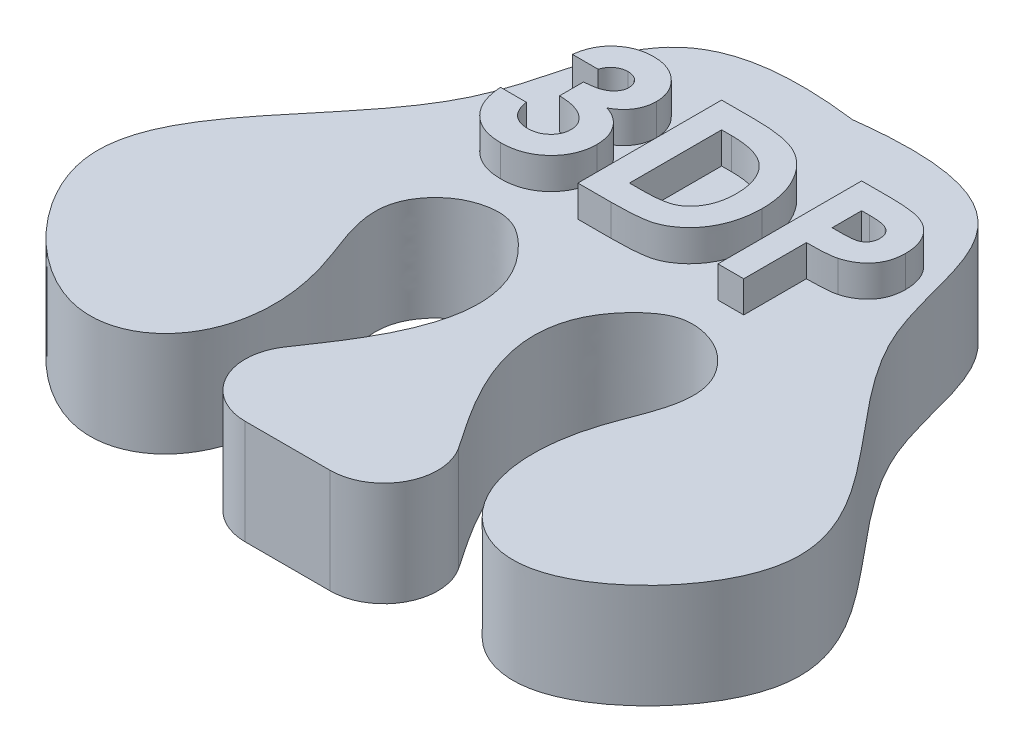
from build123d import *

# Parameters (mm, degrees)
BOSS_EXTRUDE1_DEPTH = 5
WRAP1_DEPTH         = 1.5


# Read off the part's stored shape, not the designer's step: Wrap1
with BuildPart() as part:
    # Sketch2 → Boss-Extrude1 (new body)
    with BuildSketch(Plane(origin=(0, 0, 0), x_dir=(1, 0, 0), z_dir=(0, 1, 0))):
        with BuildLine():
            Line((-2.033060379, 17.130364477), (2.033060379, 17.130364477))
            ThreePointArc((2.033060379, 17.130364477), (4.298807796, 18.478662036), (4.19447333, 21.113169957))
            add(Edge.make_bspline(
                [(4.19447333, 21.113169957), (2.913147748, 23.084440082), (-1.208334427, 28.191823288), (4.215434556, 32.11468649), (6.019088625, 31.625815878), (8.498707368, 29.482715715), (4.128659757, 21.818505746), (9.737304246, 14.542617248), (20.887637155, 26.212752035), (6.60070431, 35.158770079), (9.55476072, 45.384136892), (0, 44.170959814)],
                knots=[0, 0, 0, 0, 0.161312628, 0.180728153, 0.192663354, 0.200534211, 0.257944819, 0.431026303, 0.565243705, 0.784852151, 1, 1, 1, 1], degree=3))
            add(Edge.make_bspline(
                [(-4.19447333, 21.113169957), (-2.913147748, 23.084440082), (1.208334427, 28.191823288), (-4.215434556, 32.11468649), (-6.019088625, 31.625815878), (-8.498707368, 29.482715715), (-4.128659757, 21.818505746), (-9.737304246, 14.542617248), (-20.887637155, 26.212752035), (-6.60070431, 35.158770079), (-9.55476072, 45.384136892), (0, 44.170959814)],
                knots=[0, 0, 0, 0, 0.161312628, 0.180728153, 0.192663354, 0.200534211, 0.257944819, 0.431026303, 0.565243705, 0.784852151, 1, 1, 1, 1], degree=3))
            ThreePointArc((-4.19447333, 21.113169957), (-4.298807796, 18.478662036), (-2.033060379, 17.130364477))
        make_face()
    extrude(amount=BOSS_EXTRUDE1_DEPTH)

    # Wrap1 outline → Wrap1 (add)
    # profile 1 of 3: a face of its own
    with BuildSketch(Plane(origin=(0, 5, 0), x_dir=(1, 0, 0), z_dir=(0, 1, 0))):
        with BuildLine():
            add(Edge.make_bspline(
                [(-7.914436912, 38.674852991), (-7.905719303, 38.736572351), (-7.88862901, 38.857569066), (-7.847734222, 39.032742167), (-7.798819643, 39.198905842), (-7.73775229, 39.355533885), (-7.666130219, 39.502905301), (-7.584681748, 39.641525798), (-7.492526388, 39.77080039), (-7.421888328, 39.848675917), (-7.386648283, 39.887526603)],
                knots=[0, 0, 0, 0, 0.138934236, 0.272371367, 0.40070198, 0.524915333, 0.646775011, 0.765706493, 0.883115226, 1, 1, 1, 1], degree=3))
            Line((-7.914436912, 38.674852991), (-6.67971469, 38.674852991))
            add(Edge.make_bspline(
                [(-5.874940384, 39.292214103), (-5.919677972, 39.290012028), (-6.008451048, 39.285642437), (-6.138263857, 39.253028968), (-6.261542776, 39.198128252), (-6.375735047, 39.1224234), (-6.479192282, 39.031505083), (-6.564100823, 38.923831207), (-6.634723721, 38.805852702), (-6.664658908, 38.718690746), (-6.67971469, 38.674852991)],
                knots=[0, 0, 0, 0, 0.123522589, 0.245106649, 0.36726561, 0.494690546, 0.622323873, 0.746002836, 0.872253148, 1, 1, 1, 1], degree=3))
            add(Edge.make_bspline(
                [(-5.180409134, 38.644536151), (-5.182801409, 38.689322754), (-5.187470622, 38.776736721), (-5.223734261, 38.901844523), (-5.286683831, 39.013367759), (-5.37108815, 39.111071753), (-5.473937747, 39.192681451), (-5.594495505, 39.251928701), (-5.730145313, 39.286739105), (-5.825582262, 39.290347771), (-5.874940384, 39.292214103)],
                knots=[0, 0, 0, 0, 0.126208081, 0.246331455, 0.363483818, 0.484754462, 0.608382757, 0.731214254, 0.860989275, 1, 1, 1, 1], degree=3))
            add(Edge.make_bspline(
                [(-6.503325801, 37.792908547), (-6.42148002, 37.799878796), (-6.268362772, 37.81291875), (-6.055827823, 37.843413138), (-5.876900792, 37.884173907), (-5.727281167, 37.933349569), (-5.603046616, 37.996503931), (-5.494515999, 38.066223558), (-5.401044297, 38.147192715), (-5.322048171, 38.236996913), (-5.258853728, 38.333438201), (-5.214128382, 38.435017595), (-5.184594101, 38.538592104), (-5.18179573, 38.609433946), (-5.180409134, 38.644536151)],
                knots=[0, 0, 0, 0, 0.141703761, 0.265099674, 0.370057991, 0.458023549, 0.535993518, 0.609847615, 0.680075159, 0.748587094, 0.815630364, 0.878070744, 0.939583928, 1, 1, 1, 1], degree=3))
            Line((-6.503325801, 37.792908547), (-6.503325801, 36.646380769))
            add(Edge.make_bspline(
                [(-4.827631356, 35.534303946), (-4.828939326, 35.572065082), (-4.831543192, 35.647238851), (-4.852817058, 35.75693916), (-4.886412987, 35.862462015), (-4.933081837, 35.963340113), (-4.995402885, 36.059201636), (-5.068941027, 36.151969857), (-5.159489851, 36.236816356), (-5.258834037, 36.320684548), (-5.374034267, 36.393792317), (-5.499480126, 36.461260046), (-5.638468526, 36.51494353), (-5.787606637, 36.562892824), (-5.949715545, 36.597914243), (-6.123788615, 36.623343207), (-6.30954504, 36.64227113), (-6.437589358, 36.644986652), (-6.503325801, 36.646380769)],
                knots=[0, 0, 0, 0, 0.05061342, 0.100759723, 0.149274813, 0.198888438, 0.249306497, 0.302322686, 0.357220648, 0.415437322, 0.476442931, 0.539828648, 0.606183849, 0.675941201, 0.749782408, 0.828287688, 0.911844924, 1, 1, 1, 1], degree=3))
            add(Edge.make_bspline(
                [(-5.910769377, 34.529714103), (-5.872600365, 34.530368638), (-5.797835808, 34.531650726), (-5.688017807, 34.545860954), (-5.583400698, 34.569265211), (-5.483789627, 34.601070728), (-5.388550464, 34.640940933), (-5.299502848, 34.692351176), (-5.214831766, 34.752122923), (-5.13545767, 34.819322234), (-5.062114369, 34.892545428), (-5.00108843, 34.973627674), (-4.945315137, 35.056021729), (-4.904064807, 35.145118101), (-4.867920632, 35.236122454), (-4.845798551, 35.33233796), (-4.82909479, 35.431746277), (-4.828124035, 35.499776966), (-4.827631356, 35.534303946)],
                knots=[0, 0, 0, 0, 0.069402223, 0.135943428, 0.201020377, 0.264180635, 0.325954798, 0.388453791, 0.450818569, 0.51426562, 0.577492176, 0.638835299, 0.698633645, 0.758057149, 0.817032435, 0.876414798, 0.937277956, 1, 1, 1, 1], degree=3))
            add(Edge.make_bspline(
                [(-7.032492467, 35.588047436), (-7.024668161, 35.544782797), (-7.009428274, 35.460513566), (-6.979703807, 35.338510454), (-6.940968681, 35.225894045), (-6.896181237, 35.121663409), (-6.847804055, 35.024450035), (-6.78935285, 34.937844251), (-6.72511062, 34.859494356), (-6.632408614, 34.766351137), (-6.499884711, 34.670650368), (-6.320933538, 34.587481847), (-6.121867304, 34.538734876), (-5.982700154, 34.532787895), (-5.910769377, 34.529714103)],
                knots=[0, 0, 0, 0, 0.077346353, 0.150652305, 0.220677485, 0.286575187, 0.35018847, 0.411378839, 0.469946039, 0.528233786, 0.642194432, 0.755364323, 0.873556122, 1, 1, 1, 1], degree=3))
            Line((-7.032492467, 35.588047436), (-8.26721469, 35.588047436))
            add(Edge.make_bspline(
                [(-5.978293249, 33.29499188), (-6.058770472, 33.296747462), (-6.216133031, 33.300180271), (-6.44630871, 33.329892966), (-6.665068904, 33.377821955), (-6.872971894, 33.44538184), (-7.069213321, 33.532995465), (-7.255572776, 33.637323633), (-7.4283315, 33.764383752), (-7.589414363, 33.908440087), (-7.735248062, 34.070063115), (-7.865589046, 34.245508919), (-7.977563274, 34.435444648), (-8.071629952, 34.639058817), (-8.147053693, 34.856708627), (-8.206547718, 35.087951475), (-8.248105269, 35.333239139), (-8.260761708, 35.50200227), (-8.26721469, 35.588047436)],
                knots=[0, 0, 0, 0, 0.066659045, 0.130342942, 0.191936224, 0.251995802, 0.311121943, 0.3697548, 0.428602208, 0.488435845, 0.548524359, 0.60866107, 0.669235799, 0.730880799, 0.794196272, 0.859830406, 0.928533466, 1, 1, 1, 1], degree=3))
            add(Edge.make_bspline(
                [(-3.592909134, 35.521901603), (-3.595270454, 35.445572438), (-3.599926496, 35.295066871), (-3.629527432, 35.073387573), (-3.68463904, 34.862036057), (-3.757141415, 34.658580406), (-3.853851713, 34.465647158), (-3.967663475, 34.278808757), (-4.107560999, 34.104544709), (-4.263033074, 33.938247924), (-4.435693878, 33.787058333), (-4.622886279, 33.655983761), (-4.820494076, 33.543498457), (-5.029767477, 33.452179682), (-5.250633778, 33.381853781), (-5.482600685, 33.331018979), (-5.72664286, 33.299917405), (-5.893220738, 33.296656995), (-5.978293249, 33.29499188)],
                knots=[0, 0, 0, 0, 0.062821161, 0.123870535, 0.183554169, 0.242266291, 0.301264887, 0.360846687, 0.4219487, 0.484789191, 0.548013913, 0.610412876, 0.672536447, 0.73482884, 0.797947255, 0.862973491, 0.930019585, 1, 1, 1, 1], degree=3))
            add(Edge.make_bspline(
                [(-4.866216426, 37.281656377), (-4.817182156, 37.265557394), (-4.720832014, 37.233923614), (-4.583881874, 37.171621242), (-4.453657939, 37.103535076), (-4.332402619, 37.0244369), (-4.218909884, 36.937525093), (-4.113871598, 36.842056701), (-4.016660183, 36.73823989), (-3.928862575, 36.625503707), (-3.850938767, 36.505651148), (-3.781021884, 36.381450736), (-3.723476392, 36.251018949), (-3.674728196, 36.115845406), (-3.637614094, 35.974715238), (-3.611482451, 35.828175314), (-3.596377719, 35.676559901), (-3.59407399, 35.57384055), (-3.592909134, 35.521901603)],
                knots=[0, 0, 0, 0, 0.066221473, 0.130122224, 0.19292189, 0.254764174, 0.315756781, 0.376302843, 0.436814419, 0.498168159, 0.559516228, 0.620243021, 0.680969814, 0.742349065, 0.804583897, 0.868102398, 0.93330738, 1, 1, 1, 1], degree=3))
            add(Edge.make_bspline(
                [(-3.945686912, 38.723084328), (-3.948554512, 38.648431275), (-3.954199936, 38.501462364), (-4.000524727, 38.286362443), (-4.073035621, 38.080688533), (-4.177784661, 37.887318321), (-4.308747639, 37.706778051), (-4.469434828, 37.545103728), (-4.655269438, 37.399760516), (-4.794777956, 37.321653056), (-4.866216426, 37.281656377)],
                knots=[0, 0, 0, 0, 0.124100703, 0.24431613, 0.364465941, 0.485853993, 0.608914794, 0.734300919, 0.863942817, 1, 1, 1, 1], degree=3))
            add(Edge.make_bspline(
                [(-5.866672155, 40.526936325), (-5.799998556, 40.525362292), (-5.668931695, 40.52226806), (-5.476296388, 40.497429247), (-5.292634744, 40.453864734), (-5.116005406, 40.396905111), (-4.949006015, 40.319402025), (-4.787950734, 40.229437437), (-4.637339452, 40.119092132), (-4.496819767, 39.994413043), (-4.367725636, 39.859560402), (-4.255929554, 39.715414019), (-4.159816455, 39.565824376), (-4.080631975, 39.409548666), (-4.01974987, 39.246322452), (-3.977495884, 39.077088669), (-3.949839624, 38.902220745), (-3.947084337, 38.783365373), (-3.945686912, 38.723084328)],
                knots=[0, 0, 0, 0, 0.068213911, 0.134094803, 0.198285615, 0.261160186, 0.323634654, 0.38636675, 0.449642386, 0.514244902, 0.578413338, 0.640374686, 0.70061485, 0.760103977, 0.81929898, 0.878465984, 0.938360402, 1, 1, 1, 1], degree=3))
            add(Edge.make_bspline(
                [(-7.386648283, 39.887526603), (-7.335819188, 39.938787267), (-7.235640384, 40.03981665), (-7.068229852, 40.16922413), (-6.892752699, 40.281217503), (-6.705689651, 40.37000666), (-6.509951552, 40.441871196), (-6.303981824, 40.490142767), (-6.088622134, 40.522171381), (-5.941666239, 40.525326311), (-5.866672155, 40.526936325)],
                knots=[0, 0, 0, 0, 0.127406864, 0.251105539, 0.372907792, 0.494496302, 0.616171436, 0.740562898, 0.867604851, 1, 1, 1, 1], degree=3))
        make_face()
    # profile 2 of 3: a face of its own
    with BuildSketch(Plane(origin=(0, 5, 0), x_dir=(1, 0, 0), z_dir=(0, 1, 0))):
        with BuildLine():
            add(Edge.make_bspline(
                [(-0.890576235, 40.350547436), (-0.769283331, 40.349699557), (-0.534822776, 40.348060598), (-0.195135816, 40.329593465), (0.120729831, 40.301192327), (0.412977778, 40.262121414), (0.68100887, 40.210419896), (0.924477486, 40.145570476), (1.144200764, 40.070712609), (1.342587926, 39.982627138), (1.523696323, 39.879928227), (1.695664526, 39.765529885), (1.858154879, 39.635241367), (2.013447679, 39.491576198), (2.159538837, 39.331906067), (2.298861296, 39.158875691), (2.428003809, 38.96997589), (2.550870075, 38.769735887), (2.661986263, 38.557307082), (2.758905955, 38.334497625), (2.840096168, 38.102741379), (2.906067421, 37.861791351), (2.958654123, 37.612447423), (2.995447979, 37.354206442), (3.018194307, 37.087307495), (3.020501732, 36.906416974), (3.021674199, 36.814501429)],
                knots=[0, 0, 0, 0, 0.060148162, 0.116267077, 0.168653955, 0.217398969, 0.262433523, 0.303932701, 0.342259967, 0.377441339, 0.411406099, 0.445398351, 0.479766387, 0.514584482, 0.550213651, 0.587000908, 0.624662987, 0.663615456, 0.703456428, 0.743450162, 0.784013386, 0.825132536, 0.867264663, 0.910306473, 0.954424205, 1, 1, 1, 1], degree=3))
            Line((-0.890576235, 40.350547436), (-2.446381356, 40.350547436))
            Line((-2.446381356, 40.350547436), (-2.446381356, 33.471380769))
            Line((-2.446381356, 33.471380769), (-0.867149585, 33.471380769))
            add(Edge.make_bspline(
                [(3.021674199, 36.814501429), (3.018604047, 36.684802612), (3.012560273, 36.429482899), (2.961650895, 36.054804163), (2.879313192, 35.695637223), (2.763538904, 35.354791625), (2.620009779, 35.035302647), (2.448548167, 34.742804345), (2.251668094, 34.478866701), (2.031663226, 34.244803908), (1.793451535, 34.043623765), (1.545901552, 33.871327695), (1.28660169, 33.735457867), (1.058122274, 33.649296078), (0.860002115, 33.595710899), (0.68605476, 33.564041543), (0.488468312, 33.534998833), (0.26540045, 33.512555251), (0.017829725, 33.492541092), (-0.255230684, 33.481666177), (-0.552896686, 33.472630737), (-0.759653868, 33.471808343), (-0.867149585, 33.471380769)],
                knots=[0, 0, 0, 0, 0.065772947, 0.129477895, 0.191430088, 0.252445668, 0.311786958, 0.36881755, 0.424091518, 0.478492106, 0.531393744, 0.58200397, 0.631201271, 0.679503008, 0.705561374, 0.735221723, 0.769132486, 0.80685832, 0.848929771, 0.895116661, 0.945469804, 1, 1, 1, 1], degree=3))
        make_face()
        with BuildLine():
            add(Edge.make_bspline(
                [(-0.566737259, 34.706102991), (-0.49000146, 34.706243603), (-0.342412974, 34.706514046), (-0.129328608, 34.71939549), (0.067720401, 34.732324907), (0.248191624, 34.756865373), (0.413398474, 34.784201725), (0.561071441, 34.822244003), (0.694254708, 34.862204192), (0.811321466, 34.913078466), (0.918545077, 34.970340848), (1.017821894, 35.037430366), (1.113651818, 35.111930746), (1.20424323, 35.19603315), (1.289938999, 35.288623903), (1.370232092, 35.390180086), (1.446194212, 35.500391846), (1.515875553, 35.619841902), (1.579550736, 35.747268832), (1.636037758, 35.881438323), (1.682873835, 36.023467717), (1.721801114, 36.172027447), (1.749619069, 36.328410894), (1.772633121, 36.49145975), (1.784497536, 36.661819998), (1.786125853, 36.777738804), (1.786951977, 36.83655004)],
                knots=[0, 0, 0, 0, 0.062614648, 0.120428813, 0.174199486, 0.223724664, 0.26902845, 0.310765001, 0.348115258, 0.382378114, 0.414753161, 0.447195432, 0.480044579, 0.513738641, 0.547962504, 0.582917814, 0.619315101, 0.657123545, 0.695686576, 0.735513716, 0.7758232, 0.817652262, 0.860742584, 0.905386927, 0.951998197, 1, 1, 1, 1], degree=3))
            Line((-0.566737259, 34.706102991), (-1.211659134, 34.706102991))
            Line((-1.211659134, 34.706102991), (-1.211659134, 39.115825214))
            Line((-1.211659134, 39.115825214), (-0.740370072, 39.115825214))
            add(Edge.make_bspline(
                [(1.137895987, 38.564609936), (1.08673033, 38.60939227), (0.982230267, 38.700855116), (0.798762498, 38.810450996), (0.596590518, 38.906741719), (0.371089239, 38.983089524), (0.124438031, 39.043468623), (-0.144832167, 39.085110611), (-0.435279353, 39.111869311), (-0.636494396, 39.114478329), (-0.740370072, 39.115825214)],
                knots=[0, 0, 0, 0, 0.101663476, 0.207636138, 0.318744567, 0.436679942, 0.563506646, 0.698681208, 0.844446556, 1, 1, 1, 1], degree=3))
            add(Edge.make_bspline(
                [(1.786951977, 36.83655004), (1.785306618, 36.926672699), (1.782098296, 37.102404901), (1.751157928, 37.358362689), (1.700792913, 37.59938529), (1.628926888, 37.824578206), (1.538337537, 38.034574346), (1.424943847, 38.227594598), (1.293625845, 38.406881437), (1.189783152, 38.51205685), (1.137895987, 38.564609936)],
                knots=[0, 0, 0, 0, 0.142276686, 0.277428514, 0.406477152, 0.530595072, 0.650142922, 0.766850697, 0.883502093, 1, 1, 1, 1], degree=3))
        make_face(mode=Mode.SUBTRACT)
    # profile 3 of 3: a face of its own
    with BuildSketch(Plane(origin=(0, 5, 0), x_dir=(1, 0, 0), z_dir=(0, 1, 0))):
        with BuildLine():
            add(Edge.make_bspline(
                [(5.634434616, 40.350547436), (5.724473844, 40.350144401), (5.898178388, 40.349366863), (6.148674632, 40.339938174), (6.379769682, 40.323041389), (6.591410444, 40.302159636), (6.783509897, 40.27288423), (6.956308607, 40.239322269), (7.109842434, 40.198434033), (7.2458427, 40.149900263), (7.367898546, 40.092680845), (7.483402743, 40.03173808), (7.589744884, 39.95900504), (7.692292376, 39.882320582), (7.785182404, 39.79435907), (7.874210004, 39.70097447), (7.955604613, 39.598463226), (8.029743385, 39.488066209), (8.096998675, 39.371823083), (8.155757395, 39.24952604), (8.203419179, 39.120981558), (8.243401488, 38.987021174), (8.275515669, 38.847650726), (8.29689189, 38.702013074), (8.311411695, 38.551125114), (8.312692867, 38.448430673), (8.313340866, 38.396489276)],
                knots=[0, 0, 0, 0, 0.070781161, 0.136551696, 0.197012482, 0.252922694, 0.303686532, 0.349719151, 0.391240471, 0.428478555, 0.463056565, 0.497150358, 0.531002334, 0.564226377, 0.59770067, 0.631421421, 0.665597347, 0.700451436, 0.735880684, 0.771092108, 0.806974845, 0.843534403, 0.880940196, 0.919294384, 0.95918024, 1, 1, 1, 1], degree=3))
            Line((5.634434616, 40.350547436), (4.256396421, 40.350547436))
            Line((4.256396421, 40.350547436), (4.256396421, 33.471380769))
            Line((4.256396421, 33.471380769), (5.491118644, 33.471380769))
            Line((5.491118644, 33.471380769), (5.491118644, 36.46999188))
            add(Edge.make_bspline(
                [(6.892583487, 36.574722783), (6.857318479, 36.565948792), (6.780923116, 36.546941502), (6.654509773, 36.527644332), (6.508831668, 36.509901771), (6.343417728, 36.494654187), (6.158172588, 36.484289383), (5.953275614, 36.476194932), (5.72863395, 36.47030943), (5.572427021, 36.470100587), (5.491118644, 36.46999188)],
                knots=[0, 0, 0, 0, 0.077372749, 0.167614291, 0.272108317, 0.390015992, 0.52136331, 0.667272254, 0.826809521, 1, 1, 1, 1], degree=3))
            add(Edge.make_bspline(
                [(8.313340866, 38.396489276), (8.312403293, 38.339027746), (8.310560846, 38.226108778), (8.292498933, 38.060583424), (8.261643479, 37.902769985), (8.221317014, 37.751337593), (8.165084627, 37.608777646), (8.100841765, 37.47168862), (8.021802668, 37.34391407), (7.931487864, 37.22385569), (7.832853795, 37.11053735), (7.723558891, 37.007230902), (7.605686361, 36.91323211), (7.479918527, 36.827555859), (7.345783219, 36.750374977), (7.203377221, 36.680966746), (7.051728104, 36.621551059), (6.946124222, 36.590477135), (6.892583487, 36.574722783)],
                knots=[0, 0, 0, 0, 0.068875425, 0.135348675, 0.199289315, 0.26155008, 0.322915384, 0.382771997, 0.442843572, 0.502652029, 0.562748843, 0.622739582, 0.682687332, 0.743329247, 0.805012514, 0.86806712, 0.933110571, 1, 1, 1, 1], degree=3))
        make_face()
        with BuildLine():
            add(Edge.make_bspline(
                [(5.927956751, 37.704714103), (6.007446342, 37.705218128), (6.153708369, 37.706145543), (6.353450648, 37.7195565), (6.513967386, 37.74003774), (6.640778589, 37.769412574), (6.740908046, 37.813992775), (6.827263433, 37.865563673), (6.901332654, 37.930773657), (6.965465696, 38.005287222), (7.016738132, 38.090907043), (7.052292895, 38.186238967), (7.07538857, 38.289279969), (7.07752167, 38.360989686), (7.078618644, 38.397867314)],
                knots=[0, 0, 0, 0, 0.155159592, 0.285495954, 0.390502806, 0.470975045, 0.538445527, 0.60365534, 0.666587169, 0.73019895, 0.794944675, 0.860228437, 0.928120706, 1, 1, 1, 1], degree=3))
            Line((5.927956751, 37.704714103), (5.491118644, 37.704714103))
            Line((5.491118644, 37.704714103), (5.491118644, 39.115825214))
            Line((5.491118644, 39.115825214), (5.879725415, 39.115825214))
            add(Edge.make_bspline(
                [(6.754779668, 38.979399432), (6.732941668, 38.990443535), (6.686706147, 39.013826164), (6.607962571, 39.04101018), (6.517093688, 39.063942892), (6.413486029, 39.082976821), (6.297552916, 39.097749127), (6.169315031, 39.109046246), (6.028583663, 39.113589257), (5.930713417, 39.115059338), (5.879725415, 39.115825214)],
                knots=[0, 0, 0, 0, 0.08210116, 0.173824981, 0.278953094, 0.396639095, 0.527315592, 0.671298143, 0.82875438, 1, 1, 1, 1], degree=3))
            add(Edge.make_bspline(
                [(7.078618644, 38.397867314), (7.077532954, 38.430086818), (7.075426455, 38.492600403), (7.059951537, 38.582823011), (7.03528897, 38.666929093), (6.999553859, 38.744040274), (6.953356821, 38.814025529), (6.897033284, 38.876857287), (6.831305989, 38.933881146), (6.780560674, 38.964064745), (6.754779668, 38.979399432)],
                knots=[0, 0, 0, 0, 0.137787685, 0.267341238, 0.390444331, 0.511777883, 0.629508981, 0.747829066, 0.87188531, 1, 1, 1, 1], degree=3))
        make_face(mode=Mode.SUBTRACT)
    extrude(amount=WRAP1_DEPTH)


solid = part.part
